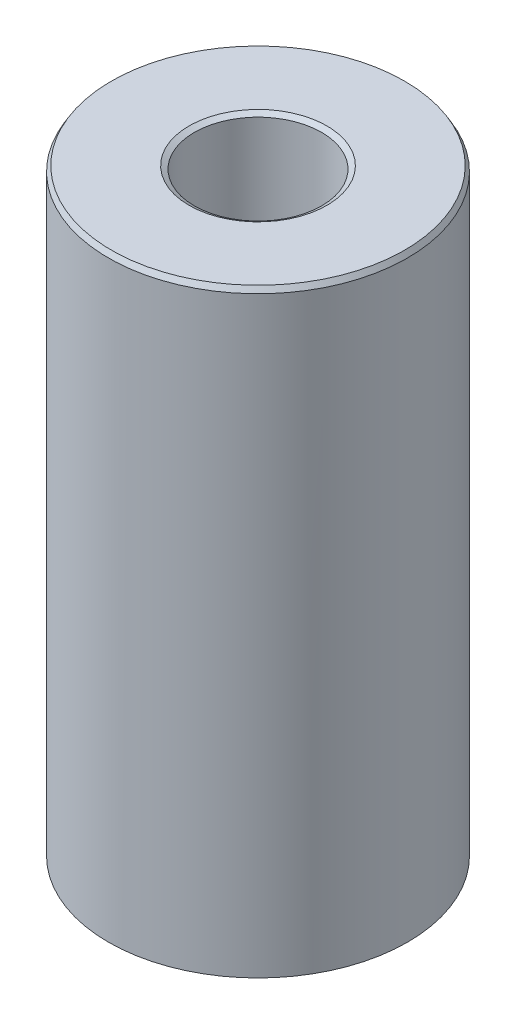
from build123d import *
from OCP.BRepFilletAPI import BRepFilletAPI_MakeChamfer

# Parameters (mm, degrees)
SKETCH1_R           = 37.5
BOSS_EXTRUDE1_DEPTH = 150.655996118
SKETCH2_R           = 15.964036419
CUT_EXTRUDE1_DEPTH  = 160.717654523
CHAMFER1_SIZE       = 1.309215347
CHAMFER1_SIZE2      = 0.755875833


with BuildPart() as part:
    # Sketch1 → Boss-Extrude1 (new body)
    with BuildSketch(Plane(origin=(0, 0, 0), x_dir=(1, 0, 0), z_dir=(0, 1, 0))):
        Circle(SKETCH1_R)
    extrude(amount=BOSS_EXTRUDE1_DEPTH)

    # Sketch2 → Cut-Extrude1 (cut, through all)
    with BuildSketch(Plane(origin=(0, 0, 0), x_dir=(1, 0, 0), z_dir=(0, 1, 0))):
        Circle(SKETCH2_R)
    extrude(amount=CUT_EXTRUDE1_DEPTH, mode=Mode.SUBTRACT)

    # Chamfer1: one chamfer whose edges measure the first distance from different faces: ONE call of the kernel's chamfer builder (chamfer() names one face for all edges)
    chamfer1_edges_1 = [part.edges().sort_by_distance(p)[0] for p in [
        (-15.964036419, 150.655996118, 0),
    ]]
    chamfer1_side_1 = [part.faces().sort_by_distance(p)[0] for p in [
        (-36.439339828, 150.655996118, 0),
    ]]
    chamfer1_edges_2 = [part.edges().sort_by_distance(p)[0] for p in [
        (-15.964036419, 0, 0),
    ]]
    chamfer1_side_2 = [part.faces().sort_by_distance(p)[0] for p in [
        (-15.964036419, 75.327998059, 0),
    ]]
    chamfer1_edges_3 = [part.edges().sort_by_distance(p)[0] for p in [
        (-37.5, 0, 0),
    ]]
    chamfer1_side_3 = [part.faces().sort_by_distance(p)[0] for p in [
        (-36.439339828, 0, 0),
    ]]
    chamfer1_edges_4 = [part.edges().sort_by_distance(p)[0] for p in [
        (-37.5, 150.655996118, 0),
    ]]
    chamfer1_side_4 = [part.faces().sort_by_distance(p)[0] for p in [
        (-37.5, 75.327998059, 0),
    ]]
    chamfer1 = BRepFilletAPI_MakeChamfer(part.part.solid().wrapped)
    for e in chamfer1_edges_1:
        chamfer1.Add(CHAMFER1_SIZE, CHAMFER1_SIZE2, e.wrapped, chamfer1_side_1[0].wrapped)  # the first distance lies on this face
    for e in chamfer1_edges_2:
        chamfer1.Add(CHAMFER1_SIZE, CHAMFER1_SIZE2, e.wrapped, chamfer1_side_2[0].wrapped)  # the first distance lies on this face
    for e in chamfer1_edges_3:
        chamfer1.Add(CHAMFER1_SIZE, CHAMFER1_SIZE2, e.wrapped, chamfer1_side_3[0].wrapped)  # the first distance lies on this face
    for e in chamfer1_edges_4:
        chamfer1.Add(CHAMFER1_SIZE, CHAMFER1_SIZE2, e.wrapped, chamfer1_side_4[0].wrapped)  # the first distance lies on this face
    add(Compound.cast(chamfer1.Shape()), mode=Mode.REPLACE)


solid = part.part
